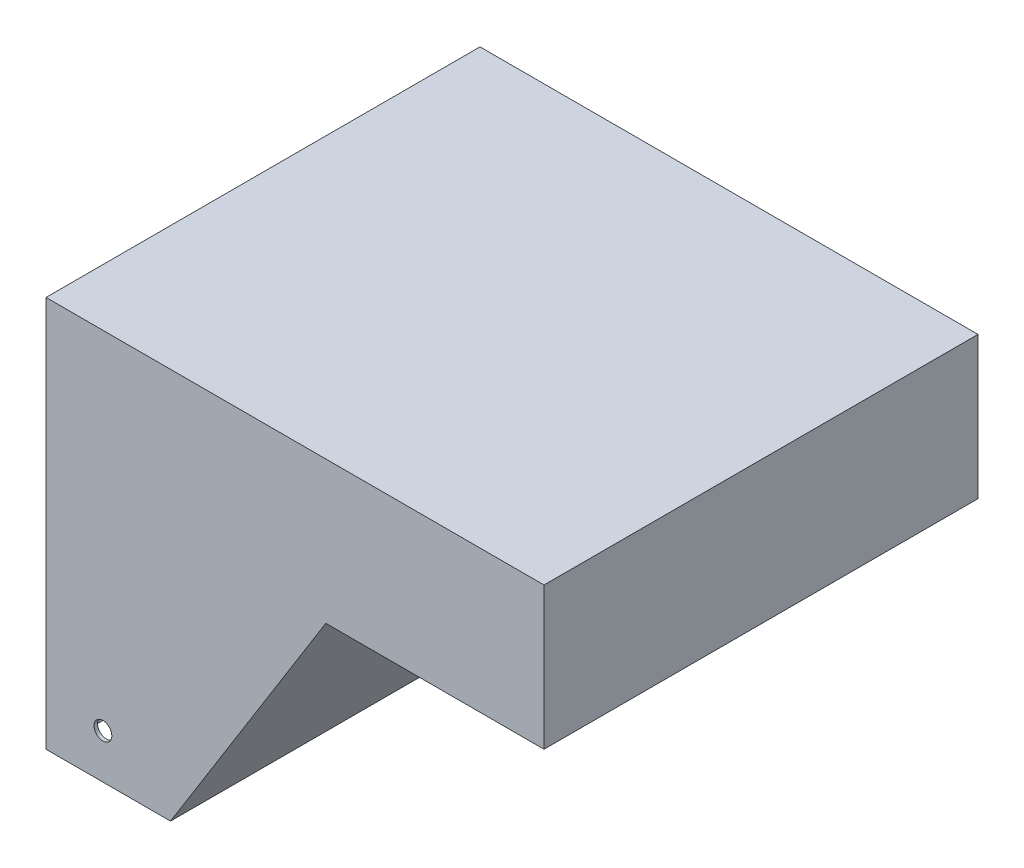
from build123d import *

# Parameters (mm, degrees)
SKETCH2_R           = 6.35
BOSS_EXTRUDE1_DEPTH = 2.54
BOSS_EXTRUDE2_DEPTH = 304.8
CUT_EXTRUDE1_REACH  = 550.217
SKETCH4_R           = 1.5875
CUT_EXTRUDE2_REACH  = 550.217
SKETCH6_R           = 1.905
CUT_EXTRUDE3_REACH  = 550.217
SKETCH7_R           = 2.54


with BuildPart() as part:
    # Sketch2 → Boss-Extrude1 (new body)
    with BuildSketch(Plane.XY):
        Polygon((0, 0), (355.6, 0), (355.6, -101.6), (199.80781759, -101.6), (88.9, -279.4), (0, -279.4), align=None)
        with Locations((40.64, -247.65)):
            Circle(SKETCH2_R, mode=Mode.SUBTRACT)
    boss_extrude1 = extrude(amount=BOSS_EXTRUDE1_DEPTH)

    # Sketch3 → Boss-Extrude2 (add)
    with BuildSketch(Plane.XY.offset(2.54)):
        Polygon((2.54, -279.4), (2.54, -276.86), (2.54, -2.54), (353.06, -2.54), (353.06, -99.06), (198.398569196, -99.06), (87.490751606, -276.86), (87.490751606, -279.4), (88.9, -279.4), (199.80781759, -101.6), (355.6, -101.6), (355.6, 0), (0, 0), (0, -279.4), align=None)
    extrude(amount=BOSS_EXTRUDE2_DEPTH)

    # Mirror1: Boss-Extrude1 across plane
    add(boss_extrude1.mirror(Plane.XY.offset(154.94)))

    # Sketch4 → Cut-Extrude1 (cut, up to next)
    with BuildSketch(Plane.ZY, mode=Mode.PRIVATE) as cut_extrude1_sk1:
        with Locations((120.015, -244.851012913)):
            Circle(SKETCH4_R)
    cut_extrude1_tool1 = extrude(cut_extrude1_sk1.sketch, amount=-CUT_EXTRUDE1_REACH, mode=Mode.PRIVATE) & part.part
    # Sketch4 → Cut-Extrude1 (cut, up to next)
    with BuildSketch(Plane.ZY, mode=Mode.PRIVATE) as cut_extrude1_sk2:
        with Locations((116.84, -273.426012913)):
            Circle(SKETCH4_R)
    cut_extrude1_tool2 = extrude(cut_extrude1_sk2.sketch, amount=-CUT_EXTRUDE1_REACH, mode=Mode.PRIVATE) & part.part
    # Sketch4 → Cut-Extrude1 (cut, up to next)
    with BuildSketch(Plane.ZY, mode=Mode.PRIVATE) as cut_extrude1_sk3:
        with Locations((189.865, -244.851012913)):
            Circle(SKETCH4_R)
    cut_extrude1_tool3 = extrude(cut_extrude1_sk3.sketch, amount=-CUT_EXTRUDE1_REACH, mode=Mode.PRIVATE) & part.part
    # Sketch4 → Cut-Extrude1 (cut, up to next)
    with BuildSketch(Plane.ZY, mode=Mode.PRIVATE) as cut_extrude1_sk4:
        with Locations((186.69, -273.426012913)):
            Circle(SKETCH4_R)
    cut_extrude1_tool4 = extrude(cut_extrude1_sk4.sketch, amount=-CUT_EXTRUDE1_REACH, mode=Mode.PRIVATE) & part.part
    add(cut_extrude1_tool1.solids().sort_by_distance((0, -244.851013, 120.015))[0], mode=Mode.SUBTRACT)
    add(cut_extrude1_tool2.solids().sort_by_distance((0, -273.426013, 116.84))[0], mode=Mode.SUBTRACT)
    add(cut_extrude1_tool3.solids().sort_by_distance((0, -244.851013, 189.865))[0], mode=Mode.SUBTRACT)
    add(cut_extrude1_tool4.solids().sort_by_distance((0, -273.426013, 186.69))[0], mode=Mode.SUBTRACT)

    # Sketch6 → Cut-Extrude2 (cut, up to next)
    with BuildSketch(Plane.ZY, mode=Mode.PRIVATE) as cut_extrude2_sk1:
        with Locations((142.24, -21.671946976)):
            Circle(SKETCH6_R)
    cut_extrude2_tool1 = extrude(cut_extrude2_sk1.sketch, amount=-CUT_EXTRUDE2_REACH, mode=Mode.PRIVATE) & part.part
    # Sketch6 → Cut-Extrude2 (cut, up to next)
    with BuildSketch(Plane.ZY, mode=Mode.PRIVATE) as cut_extrude2_sk2:
        with Locations((167.64, -21.671946976)):
            Circle(SKETCH6_R)
    cut_extrude2_tool2 = extrude(cut_extrude2_sk2.sketch, amount=-CUT_EXTRUDE2_REACH, mode=Mode.PRIVATE) & part.part
    add(cut_extrude2_tool1.solids().sort_by_distance((0, -21.671947, 142.24))[0], mode=Mode.SUBTRACT)
    add(cut_extrude2_tool2.solids().sort_by_distance((0, -21.671947, 167.64))[0], mode=Mode.SUBTRACT)

    # Sketch7 → Cut-Extrude3 (cut, up to next)
    with BuildSketch(Plane.ZY, mode=Mode.PRIVATE) as cut_extrude3_sk1:
        with Locations((120.015, -109.22)):
            Circle(SKETCH7_R)
    cut_extrude3_tool1 = extrude(cut_extrude3_sk1.sketch, amount=-CUT_EXTRUDE3_REACH, mode=Mode.PRIVATE) & part.part
    # Sketch7 → Cut-Extrude3 (cut, up to next)
    with BuildSketch(Plane.ZY, mode=Mode.PRIVATE) as cut_extrude3_sk2:
        with Locations((189.865, -109.22)):
            Circle(SKETCH7_R)
    cut_extrude3_tool2 = extrude(cut_extrude3_sk2.sketch, amount=-CUT_EXTRUDE3_REACH, mode=Mode.PRIVATE) & part.part
    # Sketch7 → Cut-Extrude3 (cut, up to next)
    with BuildSketch(Plane.ZY, mode=Mode.PRIVATE) as cut_extrude3_sk3:
        with Locations((116.84, -140.97)):
            Circle(SKETCH7_R)
    cut_extrude3_tool3 = extrude(cut_extrude3_sk3.sketch, amount=-CUT_EXTRUDE3_REACH, mode=Mode.PRIVATE) & part.part
    # Sketch7 → Cut-Extrude3 (cut, up to next)
    with BuildSketch(Plane.ZY, mode=Mode.PRIVATE) as cut_extrude3_sk4:
        with Locations((186.69, -140.97)):
            Circle(SKETCH7_R)
    cut_extrude3_tool4 = extrude(cut_extrude3_sk4.sketch, amount=-CUT_EXTRUDE3_REACH, mode=Mode.PRIVATE) & part.part
    add(cut_extrude3_tool1.solids().sort_by_distance((0, -109.22, 120.015))[0], mode=Mode.SUBTRACT)
    add(cut_extrude3_tool2.solids().sort_by_distance((0, -109.22, 189.865))[0], mode=Mode.SUBTRACT)
    add(cut_extrude3_tool3.solids().sort_by_distance((0, -140.97, 116.84))[0], mode=Mode.SUBTRACT)
    add(cut_extrude3_tool4.solids().sort_by_distance((0, -140.97, 186.69))[0], mode=Mode.SUBTRACT)


solid = part.part
